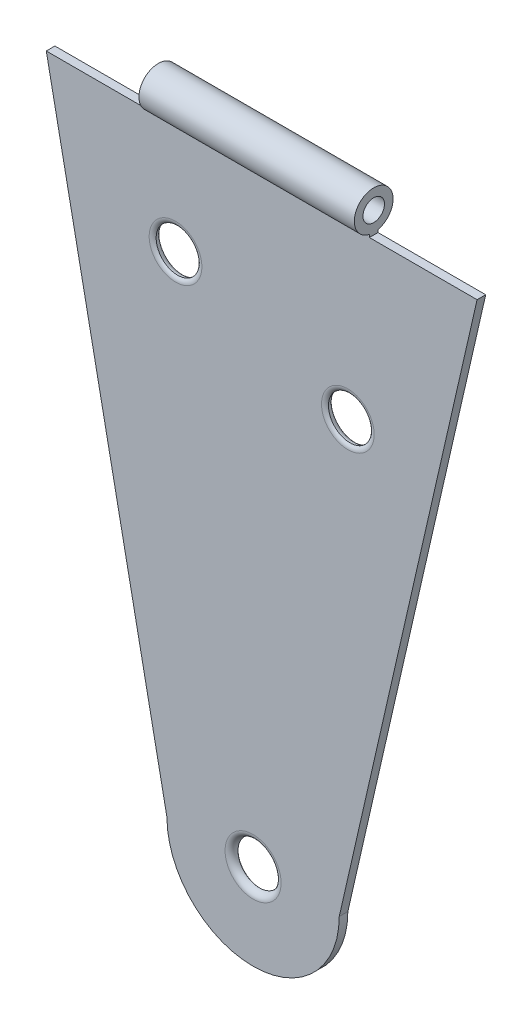
from build123d import *
from build123d.topology import SkipClean

# Parameters (mm, degrees)
ESBO_O1_R                  = 0.5
RESSALTO_EXTRUS_O1_DEPTH   = 0.2
FILETE1_R                  = 0.15
FILETE2_R                  = 0.15
ESBO_O6_W                  = 10
ESBO_O6_H                  = 0.2
RESSALTO_EXTRUS_O2_DEPTH   = 0.5
RESSALTO_EXTRUS_O3_DEPTH   = 10
CORTE_EXTRUS_O1_DEPTH      = 10
CORTE_EXTRUS_O2_DEPTH      = 10
CORTE_EXTRUS_O2_DEPTH_BACK = 10
ESBO_O9_W                  = 2.5
ESBO_O9_H                  = 2


with BuildPart() as part:
    # Esboço1 → Ressalto-extrusão1 (new body)
    with BuildSketch(Plane.XY):
        with BuildLine():
            Line((-19.847807635, 8.186498983), (-9.847807635, 8.186498983))
            Line((-9.847807635, 8.186498983), (-13.047807635, -5.813501017))
            ThreePointArc((-13.047807635, -5.813501017), (-15.047807635, -7.813501017), (-17.047807635, -5.813501017))
            Line((-17.047807635, -5.813501017), (-19.847807635, 8.186498983))
        make_face()
        with Locations((-12.847807635, 4.283271461)):
            Circle(ESBO_O1_R, mode=Mode.SUBTRACT)
        with Locations((-16.847807635, 5.652628285)):
            Circle(ESBO_O1_R, mode=Mode.SUBTRACT)
        with Locations((-15.047807635, -5.813501017)):
            Circle(ESBO_O1_R, mode=Mode.SUBTRACT)
    extrude(amount=RESSALTO_EXTRUS_O1_DEPTH)

    # Filete1
    filete1_edges = [part.edges().sort_by_distance(p)[0] for p in [
        (-17.347807635, 5.652628285, 0),
        (-13.347807635, 4.283271461, 0),
        (-15.547807635, -5.813501017, 0.2),
    ]]
    fillet(filete1_edges, radius=FILETE1_R)

    # Filete2
    # the kernel refuses this fillet: 0.15 mm, written as the material it takes off along each edge
    with BuildSketch(Plane(origin=(-15.047807635, -5.813501017, 0), x_dir=(1, 0, 0), z_dir=(0, -1, 0))) as filete2_piece_1:
        with BuildLine():
            CenterArc((0.611803399, 0.15), FILETE2_R, 221.810314896, 48.189685104)
            Line((0.5, 0.05), (0.497763932, 0.048))
            ThreePointArc((0.497763932, 0.048), (0.497, 0.025), (0.497, 0))
            Line((0.497, 0), (0.5, -0.003))
            Line((0.5, -0.003), (0.611803399, -0.003))
            Line((0.611803399, -0.003), (0.611803399, 0))
        make_face()
    revolve(axis=Axis((-15.047807635, -5.813501017, 0), (0, 0, 1)), mode=Mode.SUBTRACT)
    with BuildSketch(Plane(origin=(-12.847807635, 4.283271461, 0.2), x_dir=(1, 0, 0), z_dir=(0, -1, 0))) as filete2_piece_2:
        with BuildLine():
            CenterArc((0.611803399, -0.15), FILETE2_R, 90, 48.189685104)
            Line((0.611803399, 0), (0.611803399, 0.003))
            Line((0.611803399, 0.003), (0.5, 0.003))
            Line((0.5, 0.003), (0.497, 0))
            ThreePointArc((0.497, 0), (0.497, -0.025), (0.497763932, -0.048))
            Line((0.497763932, -0.048), (0.5, -0.05))
        make_face()
    revolve(axis=Axis((-12.847807635, 4.283271461, 0.2), (0, 0, 1)), mode=Mode.SUBTRACT)
    with BuildSketch(Plane(origin=(-16.847807635, 5.652628285, 0.2), x_dir=(1, 0, 0), z_dir=(0, -1, 0))) as filete2_piece_3:
        with BuildLine():
            CenterArc((0.611803399, -0.15), FILETE2_R, 90, 48.189685104)
            Line((0.5, -0.05), (0.497763932, -0.048))
            ThreePointArc((0.497763932, -0.048), (0.497, -0.025), (0.497, 0))
            Line((0.497, 0), (0.5, 0.003))
            Line((0.5, 0.003), (0.611803399, 0.003))
            Line((0.611803399, 0.003), (0.611803399, 0))
        make_face()
    revolve(axis=Axis((-16.847807635, 5.652628285, 0.2), (0, 0, 1)), mode=Mode.SUBTRACT)

    # Esboço6 → Ressalto-extrusão2 (add)
    with BuildSketch(Plane(origin=(0, 8.186498983, 0), x_dir=(1, 0, 0), z_dir=(0, 1, 0))):
        with Locations((-14.847807635, -0.1)):
            Rectangle(ESBO_O6_W, ESBO_O6_H)
    extrude(amount=RESSALTO_EXTRUS_O2_DEPTH)

    # Esboço7 → Ressalto-extrusão3 (add)
    with BuildSketch(Plane(origin=(-9.847807635, 0, 0), x_dir=(0, 0, -1), z_dir=(1, 0, 0))):
        with BuildLine():
            ThreePointArc((0.35, 8.686498983), (-0.380624304, 9.038280165), (-0.2, 8.247750764))
            Line((-0.2, 8.247750764), (-0.2, 8.457370198))
            ThreePointArc((-0.2, 8.457370198), (-0.236930639, 8.89566399), (0.15, 8.686498983))
            ThreePointArc((0.15, 8.686498983), (0.109165007, 8.549568344), (0, 8.457370198))
            Line((0, 8.457370198), (0, 8.247750764))
            ThreePointArc((0, 8.247750764), (0.251781182, 8.405874679), (0.35, 8.686498983))
        make_face()
        with BuildLine():
            Line((-0.2, 8.457370198), (-0.2, 8.247750764))
            ThreePointArc((-0.2, 8.247750764), (-0.1, 8.236498983), (0, 8.247750764))
            Line((0, 8.247750764), (0, 8.457370198))
            ThreePointArc((0, 8.457370198), (-0.1, 8.436498983), (-0.2, 8.457370198))
        make_face()
    extrude(amount=-RESSALTO_EXTRUS_O3_DEPTH)

    # Esboço8 → Corte-extrusão1 (cut)
    with SkipClean():  # the faces are left unmerged after this step: merging them gives an invalid solid
        with BuildSketch(Plane(origin=(-9.847807635, 0, 0), x_dir=(0, 0, -1), z_dir=(1, 0, 0))):
            with BuildLine():
                ThreePointArc((-0.2, 8.457370198), (-0.1, 8.936498983), (0, 8.457370198))
                Line((0, 8.457370198), (0, 8.686498983))
                Line((0, 8.686498983), (-0.2, 8.686498983))
                Line((-0.2, 8.686498983), (-0.2, 8.457370198))
            make_face()
            with BuildLine():
                Line((0, 8.686498983), (0, 8.457370198))
                ThreePointArc((0, 8.457370198), (0.109165007, 8.549568344), (0.15, 8.686498983))
                ThreePointArc((0.15, 8.686498983), (-0.236930639, 8.89566399), (-0.2, 8.457370198))
                Line((-0.2, 8.457370198), (-0.2, 8.686498983))
                Line((-0.2, 8.686498983), (0, 8.686498983))
            make_face()
            with BuildLine():
                ThreePointArc((-0.2, 8.457370198), (-0.1, 8.436498983), (0, 8.457370198))
                Line((0, 8.457370198), (0, 8.686498983))
                Line((0, 8.686498983), (-0.2, 8.686498983))
                Line((-0.2, 8.686498983), (-0.2, 8.457370198))
            make_face()
        extrude(amount=-CORTE_EXTRUS_O1_DEPTH, mode=Mode.SUBTRACT)

    # Esboço9 → Corte-extrusão2 (cut, two sides: drawn at the far end of the back side and taken through both)
    with BuildSketch(Plane(origin=(0, 0, 0), x_dir=(-1, 0, 0), z_dir=(0, 0, -1)).offset(-CORTE_EXTRUS_O2_DEPTH_BACK)):
        with Locations((11.097807635, 9.186498983)):
            Rectangle(ESBO_O9_W, ESBO_O9_H)
        with Locations((18.597807635, 9.186498983)):
            Rectangle(ESBO_O9_W, ESBO_O9_H)
    extrude(amount=CORTE_EXTRUS_O2_DEPTH + CORTE_EXTRUS_O2_DEPTH_BACK, mode=Mode.SUBTRACT)


solid = part.part
